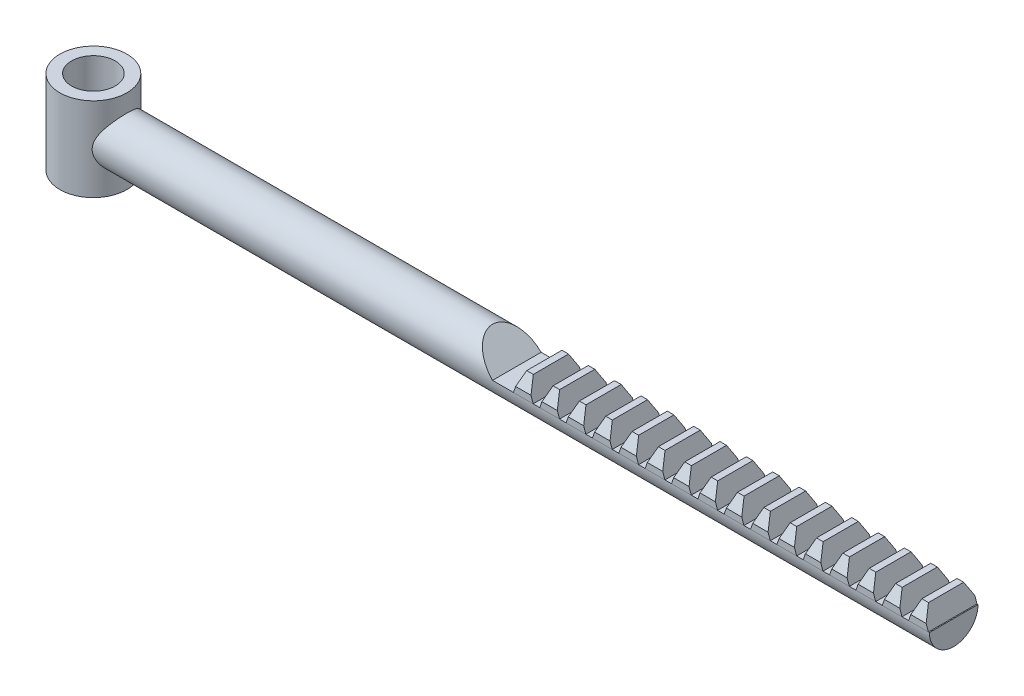
from build123d import *
from build123d.topology import SkipClean

# Parameters (mm, degrees)
SKETCH_1_R           = 4
SKETCH_1_R_2         = 2.6
EXTRUDE_1_DEPTH      = 10
SKETCH_3_R           = 2.9
EXTRUDE_2_DEPTH      = 100
SKETCH_4_W           = 55
SKETCH_4_H           = 5.8
CUT_EXTRUDE_1_DEPTH  = 5
EXTRUDE_3_DEPTH      = 2.9
EXTRUDE_3_DEPTH_BACK = 2.9
CUT_EXTRUDE_2_REACH  = 58.045
CUT_EXTRUDE_3_REACH  = 109.143


with BuildPart() as part:
    # 草图1 → 凸台-拉伸1 (new body)
    with BuildSketch(Plane(origin=(0, 0, 0), x_dir=(1, 0, 0), z_dir=(0, 1, 0))):
        Circle(SKETCH_1_R)
        Circle(SKETCH_1_R_2, mode=Mode.SUBTRACT)
    extrude(amount=EXTRUDE_1_DEPTH)

    # 草图3 → 凸台-拉伸2 (add)
    with BuildSketch(Plane.ZY.offset(-2.6)):
        with Locations((0, 5)):
            Circle(SKETCH_3_R)
    extrude(amount=-EXTRUDE_2_DEPTH)

    # 草图4 → 切除-拉伸1 (cut)
    with BuildSketch(Plane(origin=(0, 10, 0), x_dir=(1, 0, 0), z_dir=(0, 1, 0))):
        with Locations((75.1, 0)):
            Rectangle(SKETCH_4_W, SKETCH_4_H)
    extrude(amount=-CUT_EXTRUDE_1_DEPTH, mode=Mode.SUBTRACT)

    # 草图5 → 凸台-拉伸3 (add, two sides: drawn at the far end of the back side and taken through both)
    with BuildSketch(Plane.XY.offset(-EXTRUDE_3_DEPTH_BACK)):
        Polygon((52.99275, 5), (55.34925, 5), (54.56375, 7.25), (53.77825, 7.25), align=None)
        Polygon((71.05925, 5), (70.27375, 7.25), (69.48825, 7.25), (68.70275, 5), align=None)
        Polygon((56.13475, 5), (58.49125, 5), (57.70575, 7.25), (56.92025, 7.25), align=None)
        Polygon((67.91725, 5), (67.13175, 7.25), (66.34625, 7.25), (65.56075, 5), align=None)
        Polygon((59.27675, 5), (61.63325, 5), (60.84775, 7.25), (60.06225, 7.25), align=None)
        Polygon((64.77525, 5), (63.98975, 7.25), (63.20425, 7.25), (62.41875, 5), align=None)
        Polygon((71.84475, 5), (74.20125, 5), (73.41575, 7.25), (72.63025, 7.25), align=None)
        Polygon((74.98675, 5), (77.34325, 5), (76.55775, 7.25), (75.77225, 7.25), align=None)
        Polygon((89.91125, 5), (89.12575, 7.25), (88.34025, 7.25), (87.55475, 5), align=None)
        Polygon((78.12875, 5), (80.48525, 5), (79.69975, 7.25), (78.91425, 7.25), align=None)
        Polygon((86.76925, 5), (85.98375, 7.25), (85.19825, 7.25), (84.41275, 5), align=None)
        Polygon((81.27075, 5), (83.62725, 5), (82.84175, 7.25), (82.05625, 7.25), align=None)
        Polygon((90.69675, 5), (93.05325, 5), (92.26775, 7.25), (91.48225, 7.25), align=None)
        Polygon((93.83875, 5), (96.19525, 5), (95.40975, 7.25), (94.62425, 7.25), align=None)
        Polygon((47.6, 5), (47.6, 7.9), (50.5, 5), align=None)
        Polygon((96.98075, 5), (99.33725, 5), (98.55175, 7.25), (97.76625, 7.25), align=None)
        Polygon((100.12275, 5), (102.47925, 5), (101.69375, 7.25), (100.90825, 7.25), align=None)
    extrude(amount=EXTRUDE_3_DEPTH + EXTRUDE_3_DEPTH_BACK)

    # 草图6 → 切除-拉伸2 (cut, up to next)
    with BuildSketch(Plane.ZY.offset(-47.6), mode=Mode.PRIVATE) as cut_extrude_2_sk1:
        with BuildLine():
            Line((0, 7.9), (-2.9, 7.9))
            Line((-2.9, 7.9), (-2.9, 5))
            ThreePointArc((-2.9, 5), (-2.05061, 7.05061), (0, 7.9))
        make_face()
    cut_extrude_2_tool1 = extrude(cut_extrude_2_sk1.sketch, amount=-CUT_EXTRUDE_2_REACH, mode=Mode.PRIVATE) & part.part
    # 草图6 → 切除-拉伸2 (cut, up to next)
    with BuildSketch(Plane.ZY.offset(-47.6), mode=Mode.PRIVATE) as cut_extrude_2_sk2:
        with BuildLine():
            Line((2.9, 7.9), (0, 7.9))
            ThreePointArc((0, 7.9), (2.05061, 7.05061), (2.9, 5))
            Line((2.9, 5), (2.9, 7.9))
        make_face()
    cut_extrude_2_tool2 = extrude(cut_extrude_2_sk2.sketch, amount=-CUT_EXTRUDE_2_REACH, mode=Mode.PRIVATE) & part.part
    add(cut_extrude_2_tool1.solids().sort_by_distance((47.6, 7.252233, -2.252233))[0], mode=Mode.SUBTRACT)
    add(cut_extrude_2_tool2.solids().sort_by_distance((47.6, 7.252233, 2.252233))[0], mode=Mode.SUBTRACT)

    # 切除-拉伸3: up to this plane
    with SkipClean():  # the faces are left unmerged after this step: merging them gives an invalid solid
        cut_extrude_3_end = Plane(origin=(50.5, 5, -2.9), z_dir=(0.7071067811935339, 0.7071067811795612, 0))
        # 草图7 → 切除-拉伸3 (cut, up to the surface)
        with BuildSketch(Plane(origin=(102.6, 0, 0), x_dir=(0, 0, -1), z_dir=(1, 0, 0)), mode=Mode.PRIVATE) as cut_extrude_3_sk1:
            Polygon((2.9, 5.75), (2.1, 7.25), (2.9, 7.25), align=None)
        cut_extrude_3_tool1 = split(extrude(cut_extrude_3_sk1.sketch, amount=-CUT_EXTRUDE_3_REACH, mode=Mode.PRIVATE), bisect_by=cut_extrude_3_end, keep=Keep.BOTH, mode=Mode.PRIVATE)
        add(cut_extrude_3_tool1.solids().sort_by_distance((102.6, 6.75, -2.633333))[0], mode=Mode.SUBTRACT)
        # 草图7 → 切除-拉伸3 (cut, up to the surface)
        with BuildSketch(Plane(origin=(102.6, 0, 0), x_dir=(0, 0, -1), z_dir=(1, 0, 0)), mode=Mode.PRIVATE) as cut_extrude_3_sk2:
            Polygon((-2.9, 5.75), (-2.1, 7.25), (-2.9, 7.25), align=None)
        cut_extrude_3_tool2 = split(extrude(cut_extrude_3_sk2.sketch, amount=-CUT_EXTRUDE_3_REACH, mode=Mode.PRIVATE), bisect_by=cut_extrude_3_end, keep=Keep.BOTH, mode=Mode.PRIVATE)
        add(cut_extrude_3_tool2.solids().sort_by_distance((102.6, 6.75, 2.633333))[0], mode=Mode.SUBTRACT)


solid = part.part
